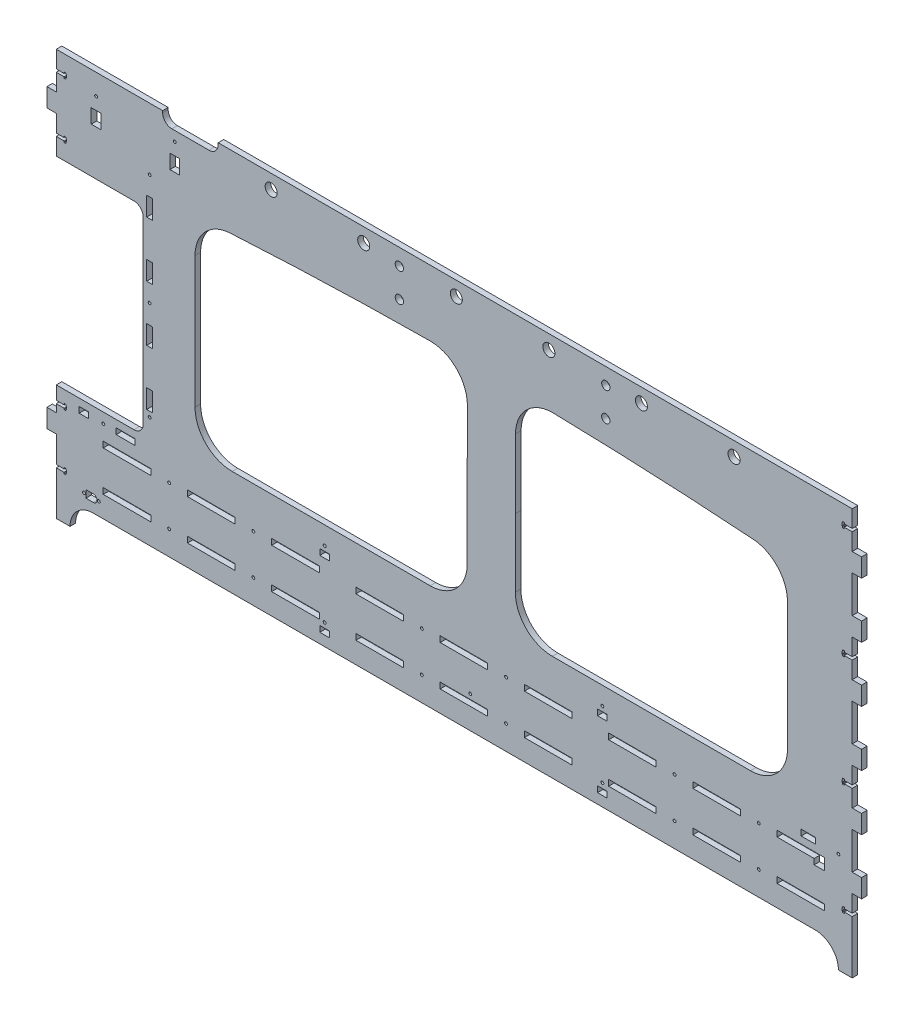
from build123d import *

# Parameters (mm, degrees)
SZKIC1_W                      = 880
SZKIC1_H                      = 439
DODANIE_WYCI_GNI_CIE1_DEPTH   = 6
WYTNIJ_WYCI_GNI_CIE1_DEPTH    = 6
WYTNIJ_WYCI_GNI_CIE2_DEPTH    = 6
WYTNIJ_WYCI_GNI_CIE3_DEPTH    = 6
SZKIC5_W                      = 10.1
SZKIC5_H                      = 40
WYTNIJ_WYCI_GNI_CIE5_DEPTH    = 6
SZYK_LINIOWY1_COUNT           = 8
SZYK_LINIOWY1_PITCH           = 60
SZYK_LINIOWY1_COUNT_DIR2      = 2
SZYK_LINIOWY1_PITCH_DIR2      = 400
WYTNIJ_WYCI_GNI_CIE6_DEPTH    = 1017.422152029
SZYK_LINIOWY2_COUNT           = 4
SZYK_LINIOWY2_PITCH           = 120
LUSTRO1_COPY_1_SKETCH_W       = 10.1
LUSTRO1_COPY_1_SKETCH_H       = 40
LUSTRO1_COPY_1_DEPTH          = 6
LUSTRO1_COPY_2_SKETCH_W       = 10.1
LUSTRO1_COPY_2_SKETCH_H       = 40
LUSTRO1_COPY_2_DEPTH          = 6
LUSTRO1_COPY_3_SKETCH_W       = 10.1
LUSTRO1_COPY_3_SKETCH_H       = 40
LUSTRO1_COPY_3_DEPTH          = 6
LUSTRO1_COPY_4_SKETCH_W       = 10.1
LUSTRO1_COPY_4_SKETCH_H       = 40
LUSTRO1_COPY_4_DEPTH          = 6
LUSTRO1_COPY_5_SKETCH_W       = 10.1
LUSTRO1_COPY_5_SKETCH_H       = 40
LUSTRO1_COPY_5_DEPTH          = 6
LUSTRO1_COPY_6_SKETCH_W       = 10.1
LUSTRO1_COPY_6_SKETCH_H       = 40
LUSTRO1_COPY_6_DEPTH          = 6
LUSTRO1_COPY_7_SKETCH_W       = 10.1
LUSTRO1_COPY_7_SKETCH_H       = 40
LUSTRO1_COPY_7_DEPTH          = 6
LUSTRO1_COPY_8_SKETCH_W       = 10.1
LUSTRO1_COPY_8_SKETCH_H       = 40
LUSTRO1_COPY_8_DEPTH          = 6
LUSTRO1_COPY_9_SKETCH_W       = 10.1
LUSTRO1_COPY_9_SKETCH_H       = 40
LUSTRO1_COPY_9_DEPTH          = 6
LUSTRO1_COPY_10_SKETCH_W      = 10.1
LUSTRO1_COPY_10_SKETCH_H      = 40
LUSTRO1_COPY_10_DEPTH         = 6
LUSTRO1_COPY_11_SKETCH_W      = 10.1
LUSTRO1_COPY_11_SKETCH_H      = 40
LUSTRO1_COPY_11_DEPTH         = 6
LUSTRO1_COPY_12_SKETCH_W      = 10.1
LUSTRO1_COPY_12_SKETCH_H      = 40
LUSTRO1_COPY_12_DEPTH         = 6
LUSTRO1_COPY_13_SKETCH_W      = 10.1
LUSTRO1_COPY_13_SKETCH_H      = 40
LUSTRO1_COPY_13_DEPTH         = 6
LUSTRO1_COPY_14_SKETCH_W      = 10.1
LUSTRO1_COPY_14_SKETCH_H      = 40
LUSTRO1_COPY_14_DEPTH         = 6
LUSTRO1_COPY_15_SKETCH_W      = 10.1
LUSTRO1_COPY_15_SKETCH_H      = 40
LUSTRO1_COPY_15_DEPTH         = 6
LUSTRO1_COPY_16_SKETCH_W      = 10.1
LUSTRO1_COPY_16_SKETCH_H      = 40
LUSTRO1_COPY_16_DEPTH         = 6
SZKIC18_W                     = 11.4
SZKIC18_H                     = 6.4
WYTNIJ_WYCI_GNI_CIE9_DEPTH    = 6
SZKIC19_R                     = 1.55
WYTNIJ_WYCI_GNI_CIE10_DEPTH   = 6
SZKIC22_R                     = 1.55
SZKIC22_W                     = 10.4
SZKIC22_H                     = 6.4
WYTNIJ_WYCI_GNI_CIE11_DEPTH   = 6
SZYK_LINIOWY5_COUNT           = 2
SZYK_LINIOWY5_PITCH           = 300
SZKIC26_R                     = 1.55
SZKIC26_W                     = 15.4
SZKIC26_H                     = 6.4
WYTNIJ_WYCI_GNI_CIE12_DEPTH   = 6
SZKIC28_R                     = 1.55
SZKIC28_W                     = 10.4
SZKIC28_H                     = 6.4
WYTNIJ_WYCI_GNI_CIE13_DEPTH   = 6
SZKIC30_R                     = 1.55
SZKIC30_W                     = 20.4
SZKIC30_H                     = 6.4
SZKIC30_W_2                   = 10.4
WYTNIJ_WYCI_GNI_CIE14_DEPTH   = 6
WYTNIJ_WYCI_GNI_CIE15_DEPTH   = 6
SZKIC33_R                     = 1.55
WYTNIJ_WYCI_GNI_CIE16_DEPTH   = 6
SZYK_LINIOWY6_COUNT           = 2
SZYK_LINIOWY6_PITCH           = 107
SZYK_LINIOWY6_COUNT_DIR2      = 2
SZYK_LINIOWY6_PITCH_DIR2      = 227
SZKIC35_W                     = 6.4
SZKIC35_H                     = 20.4
WYTNIJ_WYCI_GNI_CIE17_DEPTH   = 6
SZYK_LINIOWY7_COUNT           = 4
SZYK_LINIOWY7_PITCH           = 60
SZKIC37_R                     = 1.55
WYTNIJ_WYCI_GNI_CIE18_DEPTH   = 6
WYTNIJ_WYCI_GNI_CIE20_DEPTH   = 10
SZYK_LINIOWY9_COUNT           = 2
SZYK_LINIOWY9_PITCH           = 60
SZYK_LINIOWY9_COUNT_DIR2      = 2
SZYK_LINIOWY9_PITCH_DIR2      = 310
SZKIC44_R                     = 6.5
WYTNIJ_WYCI_GNI_CIE22_DEPTH   = 10
SZYK_LINIOWY10_COUNT          = 6
SZYK_LINIOWY10_PITCH          = 100
SZKIC45_R                     = 1.55
SZKIC45_W                     = 10.4
SZKIC45_H                     = 15.4
WYTNIJ_WYCI_GNI_CIE23_DEPTH   = 10
SZKIC49_R                     = 1.55
WYTNIJ_WYCI_GNI_CIE26_DEPTH   = 10
SZYK_LINIOWY12_COUNT          = 2
SZYK_LINIOWY12_PITCH          = 91
SZYK_LINIOWY12_COUNT_DIR2     = 3
SZYK_LINIOWY12_PITCH_DIR2     = 273
SZKIC52_W                     = 51.4
SZKIC52_H                     = 6.4
WYTNIJ_WYCI_GNI_CIE27_DEPTH   = 6
SZYK_LINIOWY13_COUNT          = 9
SZYK_LINIOWY13_PITCH          = 91
SZYK_LINIOWY4_COPY_1_SKETCH_W = 51.4
SZYK_LINIOWY4_COPY_1_SKETCH_H = 6.4
SZYK_LINIOWY4_COPY_1_DEPTH    = 6
SZYK_LINIOWY4_COPY_2_SKETCH_W = 51.4
SZYK_LINIOWY4_COPY_2_SKETCH_H = 6.4
SZYK_LINIOWY4_COPY_2_DEPTH    = 6
SZYK_LINIOWY4_COPY_3_SKETCH_W = 51.4
SZYK_LINIOWY4_COPY_3_SKETCH_H = 6.4
SZYK_LINIOWY4_COPY_3_DEPTH    = 6
SZYK_LINIOWY4_COPY_4_SKETCH_W = 51.4
SZYK_LINIOWY4_COPY_4_SKETCH_H = 6.4
SZYK_LINIOWY4_COPY_4_DEPTH    = 6
SZYK_LINIOWY4_COPY_5_SKETCH_W = 51.4
SZYK_LINIOWY4_COPY_5_SKETCH_H = 6.4
SZYK_LINIOWY4_COPY_5_DEPTH    = 6
SZYK_LINIOWY4_COPY_6_SKETCH_W = 51.4
SZYK_LINIOWY4_COPY_6_SKETCH_H = 6.4
SZYK_LINIOWY4_COPY_6_DEPTH    = 6
SZYK_LINIOWY4_COPY_7_SKETCH_W = 51.4
SZYK_LINIOWY4_COPY_7_SKETCH_H = 6.4
SZYK_LINIOWY4_COPY_7_DEPTH    = 6
SZYK_LINIOWY4_COPY_8_SKETCH_W = 51.4
SZYK_LINIOWY4_COPY_8_SKETCH_H = 6.4
SZYK_LINIOWY4_COPY_8_DEPTH    = 6
SZYK_LINIOWY4_COPY_9_SKETCH_W = 51.4
SZYK_LINIOWY4_COPY_9_SKETCH_H = 6.4
SZYK_LINIOWY4_COPY_9_DEPTH    = 6
SZKIC55_R                     = 4.5
WYTNIJ_WYCI_GNI_CIE28_DEPTH   = 10
DODANIE_WYCI_GNI_CIE2_DEPTH   = 6
SZKIC58_R                     = 1.55
WYTNIJ_WYCI_GNI_CIE30_DEPTH   = 6


with BuildPart() as part:
    # Szkic1 → Dodanie-wyciągnięcie1 (new body)
    with BuildSketch(Plane.XY):
        with Locations((440, -289.103962956)):
            Rectangle(SZKIC1_W, SZKIC1_H)
    extrude(amount=DODANIE_WYCI_GNI_CIE1_DEPTH)

    # Szkic2 → Wytnij-wyciągnięcie1 (cut)
    with BuildSketch(Plane.XY.offset(6)):
        with BuildLine():
            Line((25, -508.603962956), (855, -508.603962956))
            ThreePointArc((855, -508.603962956), (847.67766953, -490.926293426), (830, -483.603962956))
            Line((830, -483.603962956), (50, -483.603962956))
            ThreePointArc((50, -483.603962956), (32.32233047, -490.926293426), (25, -508.603962956))
        make_face()
    extrude(amount=-WYTNIJ_WYCI_GNI_CIE1_DEPTH, mode=Mode.SUBTRACT)

    # Szkic3 → Wytnij-wyciągnięcie2 (cut)
    with BuildSketch(Plane.XY.offset(6)):
        with BuildLine():
            Line((160, -187.643714192), (160, -329.603962956))
            ThreePointArc((160, -329.603962956), (171.715728753, -357.888234203), (200, -369.603962956))
            Line((200, -369.603962956), (760, -369.603962956))
            ThreePointArc((760, -369.603962956), (788.284271247, -357.888234203), (800, -329.603962956))
            Line((800, -329.603962956), (800, -191.492601365))
            ThreePointArc((800, -191.492601365), (789.276269567, -164.23640867), (762.854997988, -151.594619129))
            ThreePointArc((762.854997988, -151.594619129), (480.337059328, -140.527171371), (197.693684509, -147.710258182))
            ThreePointArc((197.693684509, -147.710258182), (170.911749626, -160.186953818), (160, -187.643714192))
        make_face()
    extrude(amount=-WYTNIJ_WYCI_GNI_CIE2_DEPTH, mode=Mode.SUBTRACT)

    # Szkic4 → Wytnij-wyciągnięcie3 (cut)
    with BuildSketch(Plane.XY.offset(6)):
        with BuildLine():
            Line((94, -383.603962956), (0, -383.603962956))
            Line((0, -383.603962956), (0, -169.603962956))
            Line((0, -169.603962956), (94, -169.603962956))
            ThreePointArc((94, -169.603962956), (101.071067812, -172.532895144), (104, -179.603962956))
            Line((104, -179.603962956), (104, -373.603962956))
            ThreePointArc((104, -373.603962956), (101.071067812, -380.675030768), (94, -383.603962956))
        make_face()
    extrude(amount=-WYTNIJ_WYCI_GNI_CIE3_DEPTH, mode=Mode.SUBTRACT)

    # Szkic5 → Wytnij-wyciągnięcie5 (cut)
    with BuildSketch(Plane(origin=(0, 0, 0), x_dir=(-1, 0, 0), z_dir=(0, 0, -1))):
        with Locations((-874.95, -89.603962956)):
            Rectangle(SZKIC5_W, SZKIC5_H)
    wytnij_wyci_gni_cie5 = extrude(amount=-WYTNIJ_WYCI_GNI_CIE5_DEPTH, mode=Mode.SUBTRACT)

    # Szyk liniowy1: Wytnij-wyci_gni_cie5 8 × 2
    with Locations(*[Vector(0, -1, 0) * (i * SZYK_LINIOWY1_PITCH) + Vector(0, -1, 0) * (j * SZYK_LINIOWY1_PITCH_DIR2) for i in range(SZYK_LINIOWY1_COUNT) for j in range(SZYK_LINIOWY1_COUNT_DIR2) if (i, j) != (0, 0)]):
        add(wytnij_wyci_gni_cie5, mode=Mode.SUBTRACT)

    # Szkic6 → Wytnij-wyciągnięcie6 (cut, through all)
    with BuildSketch(Plane(origin=(0, 0, 0), x_dir=(-1, 0, 0), z_dir=(0, 0, -1))):
        Polygon((-869.9, -88.053962956), (-869.9, -91.153962956), (-861.4, -91.153962956), (-861.4, -92.533962956), (-859.4, -92.533962956), (-859.4, -91.153962956), (-858.9, -91.153962956), (-858.9, -88.053962956), (-859.4, -88.053962956), (-859.4, -86.683962956), (-861.4, -86.683962956), (-861.4, -88.053962956), align=None)
    wytnij_wyci_gni_cie6 = extrude(amount=-WYTNIJ_WYCI_GNI_CIE6_DEPTH, mode=Mode.SUBTRACT)

    # Szyk liniowy2: Wytnij-wyciągnięcie6 ×4
    with Locations(*[(0, -i * SZYK_LINIOWY2_PITCH, 0) for i in range(1, SZYK_LINIOWY2_COUNT)]):
        add(wytnij_wyci_gni_cie6, mode=Mode.SUBTRACT)

    # Lustro1 copy 1 sketch → Lustro1 copy 1 (cut)
    with BuildSketch(Plane(origin=(880, -400, 0), x_dir=(1, 0, 0), z_dir=(0, 0, -1))):
        with Locations((-874.95, 89.603962956)):
            Rectangle(LUSTRO1_COPY_1_SKETCH_W, LUSTRO1_COPY_1_SKETCH_H)
    extrude(amount=-LUSTRO1_COPY_1_DEPTH, mode=Mode.SUBTRACT)

    # Lustro1 copy 2 sketch → Lustro1 copy 2 (cut)
    with BuildSketch(Plane(origin=(880, -60, 0), x_dir=(1, 0, 0), z_dir=(0, 0, -1))):
        with Locations((-874.95, 89.603962956)):
            Rectangle(LUSTRO1_COPY_2_SKETCH_W, LUSTRO1_COPY_2_SKETCH_H)
    extrude(amount=-LUSTRO1_COPY_2_DEPTH, mode=Mode.SUBTRACT)

    # Lustro1 copy 3 sketch → Lustro1 copy 3 (cut)
    with BuildSketch(Plane(origin=(880, -460, 0), x_dir=(1, 0, 0), z_dir=(0, 0, -1))):
        with Locations((-874.95, 89.603962956)):
            Rectangle(LUSTRO1_COPY_3_SKETCH_W, LUSTRO1_COPY_3_SKETCH_H)
    extrude(amount=-LUSTRO1_COPY_3_DEPTH, mode=Mode.SUBTRACT)

    # Lustro1 copy 4 sketch → Lustro1 copy 4 (cut)
    with BuildSketch(Plane(origin=(880, -120, 0), x_dir=(1, 0, 0), z_dir=(0, 0, -1))):
        with Locations((-874.95, 89.603962956)):
            Rectangle(LUSTRO1_COPY_4_SKETCH_W, LUSTRO1_COPY_4_SKETCH_H)
    extrude(amount=-LUSTRO1_COPY_4_DEPTH, mode=Mode.SUBTRACT)

    # Lustro1 copy 5 sketch → Lustro1 copy 5 (cut)
    with BuildSketch(Plane(origin=(880, -520, 0), x_dir=(1, 0, 0), z_dir=(0, 0, -1))):
        with Locations((-874.95, 89.603962956)):
            Rectangle(LUSTRO1_COPY_5_SKETCH_W, LUSTRO1_COPY_5_SKETCH_H)
    extrude(amount=-LUSTRO1_COPY_5_DEPTH, mode=Mode.SUBTRACT)

    # Lustro1 copy 6 sketch → Lustro1 copy 6 (cut)
    with BuildSketch(Plane(origin=(880, -180, 0), x_dir=(1, 0, 0), z_dir=(0, 0, -1))):
        with Locations((-874.95, 89.603962956)):
            Rectangle(LUSTRO1_COPY_6_SKETCH_W, LUSTRO1_COPY_6_SKETCH_H)
    extrude(amount=-LUSTRO1_COPY_6_DEPTH, mode=Mode.SUBTRACT)

    # Lustro1 copy 7 sketch → Lustro1 copy 7 (cut)
    with BuildSketch(Plane(origin=(880, -580, 0), x_dir=(1, 0, 0), z_dir=(0, 0, -1))):
        with Locations((-874.95, 89.603962956)):
            Rectangle(LUSTRO1_COPY_7_SKETCH_W, LUSTRO1_COPY_7_SKETCH_H)
    extrude(amount=-LUSTRO1_COPY_7_DEPTH, mode=Mode.SUBTRACT)

    # Lustro1 copy 8 sketch → Lustro1 copy 8 (cut)
    with BuildSketch(Plane(origin=(880, -240, 0), x_dir=(1, 0, 0), z_dir=(0, 0, -1))):
        with Locations((-874.95, 89.603962956)):
            Rectangle(LUSTRO1_COPY_8_SKETCH_W, LUSTRO1_COPY_8_SKETCH_H)
    extrude(amount=-LUSTRO1_COPY_8_DEPTH, mode=Mode.SUBTRACT)

    # Lustro1 copy 9 sketch → Lustro1 copy 9 (cut)
    with BuildSketch(Plane(origin=(880, -640, 0), x_dir=(1, 0, 0), z_dir=(0, 0, -1))):
        with Locations((-874.95, 89.603962956)):
            Rectangle(LUSTRO1_COPY_9_SKETCH_W, LUSTRO1_COPY_9_SKETCH_H)
    extrude(amount=-LUSTRO1_COPY_9_DEPTH, mode=Mode.SUBTRACT)

    # Lustro1 copy 10 sketch → Lustro1 copy 10 (cut)
    with BuildSketch(Plane(origin=(880, -300, 0), x_dir=(1, 0, 0), z_dir=(0, 0, -1))):
        with Locations((-874.95, 89.603962956)):
            Rectangle(LUSTRO1_COPY_10_SKETCH_W, LUSTRO1_COPY_10_SKETCH_H)
    extrude(amount=-LUSTRO1_COPY_10_DEPTH, mode=Mode.SUBTRACT)

    # Lustro1 copy 11 sketch → Lustro1 copy 11 (cut)
    with BuildSketch(Plane(origin=(880, -700, 0), x_dir=(1, 0, 0), z_dir=(0, 0, -1))):
        with Locations((-874.95, 89.603962956)):
            Rectangle(LUSTRO1_COPY_11_SKETCH_W, LUSTRO1_COPY_11_SKETCH_H)
    extrude(amount=-LUSTRO1_COPY_11_DEPTH, mode=Mode.SUBTRACT)

    # Lustro1 copy 12 sketch → Lustro1 copy 12 (cut)
    with BuildSketch(Plane(origin=(880, -360, 0), x_dir=(1, 0, 0), z_dir=(0, 0, -1))):
        with Locations((-874.95, 89.603962956)):
            Rectangle(LUSTRO1_COPY_12_SKETCH_W, LUSTRO1_COPY_12_SKETCH_H)
    extrude(amount=-LUSTRO1_COPY_12_DEPTH, mode=Mode.SUBTRACT)

    # Lustro1 copy 13 sketch → Lustro1 copy 13 (cut)
    with BuildSketch(Plane(origin=(880, -760, 0), x_dir=(1, 0, 0), z_dir=(0, 0, -1))):
        with Locations((-874.95, 89.603962956)):
            Rectangle(LUSTRO1_COPY_13_SKETCH_W, LUSTRO1_COPY_13_SKETCH_H)
    extrude(amount=-LUSTRO1_COPY_13_DEPTH, mode=Mode.SUBTRACT)

    # Lustro1 copy 14 sketch → Lustro1 copy 14 (cut)
    with BuildSketch(Plane(origin=(880, -420, 0), x_dir=(1, 0, 0), z_dir=(0, 0, -1))):
        with Locations((-874.95, 89.603962956)):
            Rectangle(LUSTRO1_COPY_14_SKETCH_W, LUSTRO1_COPY_14_SKETCH_H)
    extrude(amount=-LUSTRO1_COPY_14_DEPTH, mode=Mode.SUBTRACT)

    # Lustro1 copy 15 sketch → Lustro1 copy 15 (cut)
    with BuildSketch(Plane(origin=(880, -820, 0), x_dir=(1, 0, 0), z_dir=(0, 0, -1))):
        with Locations((-874.95, 89.603962956)):
            Rectangle(LUSTRO1_COPY_15_SKETCH_W, LUSTRO1_COPY_15_SKETCH_H)
    extrude(amount=-LUSTRO1_COPY_15_DEPTH, mode=Mode.SUBTRACT)

    # Lustro1 copy 16 sketch → Lustro1 copy 16 (cut)
    with BuildSketch(Plane(origin=(880, 0, 0), x_dir=(1, 0, 0), z_dir=(0, 0, -1))):
        with Locations((-874.95, 89.603962956)):
            Rectangle(LUSTRO1_COPY_16_SKETCH_W, LUSTRO1_COPY_16_SKETCH_H)
    extrude(amount=-LUSTRO1_COPY_16_DEPTH, mode=Mode.SUBTRACT)

    # Szkic18 → Wytnij-wyciągnięcie9 (cut)
    with BuildSketch(Plane(origin=(0, 0, 0), x_dir=(-1, 0, 0), z_dir=(0, 0, -1))):
        with Locations((-834.5, -420.103962956)):
            Rectangle(SZKIC18_W, SZKIC18_H)
    extrude(amount=-WYTNIJ_WYCI_GNI_CIE9_DEPTH, mode=Mode.SUBTRACT)

    # Szkic19 → Wytnij-wyciągnięcie10 (cut)
    with BuildSketch(Plane(origin=(0, 0, 0), x_dir=(-1, 0, 0), z_dir=(0, 0, -1))):
        with Locations((-769, -414.103962956)):
            Circle(SZKIC19_R)
    wytnij_wyci_gni_cie10 = extrude(amount=-WYTNIJ_WYCI_GNI_CIE10_DEPTH, mode=Mode.SUBTRACT)

    # Szkic22 → Wytnij-wyciągnięcie11 (cut)
    with BuildSketch(Plane(origin=(0, 0, 0), x_dir=(-1, 0, 0), z_dir=(0, 0, -1))):
        with Locations((-300.034826328, -460.972699115)):
            Circle(SZKIC22_R)
        with Locations((-300, -469.522699115)):
            Rectangle(SZKIC22_W, SZKIC22_H)
    wytnij_wyci_gni_cie11 = extrude(amount=-WYTNIJ_WYCI_GNI_CIE11_DEPTH, mode=Mode.SUBTRACT)

    # Szyk liniowy5: Wytnij-wyciągnięcie11 ×2
    with Locations(*[(i * SZYK_LINIOWY5_PITCH, 0, 0) for i in range(1, SZYK_LINIOWY5_COUNT)]):
        add(wytnij_wyci_gni_cie11, mode=Mode.SUBTRACT)

    # Szkic26 → Wytnij-wyciągnięcie12 (cut)
    with BuildSketch(Plane(origin=(0, 0, 0), x_dir=(-1, 0, 0), z_dir=(0, 0, -1))):
        with Locations((-855, -400.103962956)):
            Circle(SZKIC26_R)
        with Locations((-822.5, -400.103962956)):
            Rectangle(SZKIC26_W, SZKIC26_H)
    extrude(amount=-WYTNIJ_WYCI_GNI_CIE12_DEPTH, mode=Mode.SUBTRACT)

    # Szkic28 → Wytnij-wyciągnięcie13 (cut)
    with BuildSketch(Plane(origin=(0, 0, 0), x_dir=(-1, 0, 0), z_dir=(0, 0, -1))):
        with Locations((-600, -389.054878368)):
            Circle(SZKIC28_R)
        with Locations((-300, -389.054878368)):
            Circle(SZKIC28_R)
        with Locations((-600, -397.604878368)):
            Rectangle(SZKIC28_W, SZKIC28_H)
        with Locations((-300, -397.604878368)):
            Rectangle(SZKIC28_W, SZKIC28_H)
    extrude(amount=-WYTNIJ_WYCI_GNI_CIE13_DEPTH, mode=Mode.SUBTRACT)

    # Szkic30 → Wytnij-wyciągnięcie14 (cut)
    with BuildSketch(Plane(origin=(0, 0, 0), x_dir=(-1, 0, 0), z_dir=(0, 0, -1))):
        with Locations((-60.95, -394.603962956)):
            Circle(SZKIC30_R)
        with Locations((-85, -394.603962956)):
            Rectangle(SZKIC30_W, SZKIC30_H)
        with Locations((-40, -394.603962956)):
            Rectangle(SZKIC30_W_2, SZKIC30_H)
    extrude(amount=-WYTNIJ_WYCI_GNI_CIE14_DEPTH, mode=Mode.SUBTRACT)

    # Szkic31 → Wytnij-wyciągnięcie15 (cut)
    with BuildSketch(Plane(origin=(0, 0, 0), x_dir=(-1, 0, 0), z_dir=(0, 0, -1))):
        with BuildLine():
            Line((-185, -69.603962956), (-125, -69.603962956))
            Line((-125, -69.603962956), (-125, -71.603962956))
            ThreePointArc((-125, -71.603962956), (-127.928932188, -78.675030768), (-135, -81.603962956))
            Line((-135, -81.603962956), (-175, -81.603962956))
            ThreePointArc((-175, -81.603962956), (-182.071067812, -78.675030768), (-185, -71.603962956))
            Line((-185, -71.603962956), (-185, -69.603962956))
        make_face()
    extrude(amount=-WYTNIJ_WYCI_GNI_CIE15_DEPTH, mode=Mode.SUBTRACT)

    # Szkic33 → Wytnij-wyciągnięcie16 (cut)
    with BuildSketch(Plane(origin=(0, 0, 0), x_dir=(-1, 0, 0), z_dir=(0, 0, -1))):
        with Locations((-111, -363.603962956)):
            Circle(SZKIC33_R)
    wytnij_wyci_gni_cie16 = extrude(amount=-WYTNIJ_WYCI_GNI_CIE16_DEPTH, mode=Mode.SUBTRACT)

    # Szyk liniowy6: Wytnij-wyci_gni_cie16 2 × 2
    with Locations(*[Vector(0, 1, 0) * (i * SZYK_LINIOWY6_PITCH) + Vector(0, 1, 0) * (j * SZYK_LINIOWY6_PITCH_DIR2) for i in range(SZYK_LINIOWY6_COUNT) for j in range(SZYK_LINIOWY6_COUNT_DIR2) if (i, j) != (0, 0)]):
        add(wytnij_wyci_gni_cie16, mode=Mode.SUBTRACT)

    # Szkic35 → Wytnij-wyciągnięcie17 (cut)
    with BuildSketch(Plane(origin=(0, 0, 0), x_dir=(-1, 0, 0), z_dir=(0, 0, -1))):
        with Locations((-111, -347.603962956)):
            Rectangle(SZKIC35_W, SZKIC35_H)
    wytnij_wyci_gni_cie17 = extrude(amount=-WYTNIJ_WYCI_GNI_CIE17_DEPTH, mode=Mode.SUBTRACT)

    # Szyk liniowy7: Wytnij-wyciągnięcie17 ×4
    with Locations(*[(0, i * SZYK_LINIOWY7_PITCH, 0) for i in range(1, SZYK_LINIOWY7_COUNT)]):
        add(wytnij_wyci_gni_cie17, mode=Mode.SUBTRACT)

    # Szkic37 → Wytnij-wyciągnięcie18 (cut)
    with BuildSketch(Plane(origin=(0, 0, 0), x_dir=(-1, 0, 0), z_dir=(0, 0, -1))):
        with Locations((-56.1, -469.603962956)):
            Circle(SZKIC37_R)
        with Locations((-40.1, -469.603962956)):
            Circle(SZKIC37_R)
        with BuildLine():
            Line((-50.1, -473.603962956), (-42.1, -473.603962956))
            Line((-42.1, -473.603962956), (-42.1, -465.603962956))
            Line((-42.1, -465.603962956), (-50.1, -465.603962956))
            ThreePointArc((-50.1, -465.603962956), (-54.1, -469.603962956), (-50.1, -473.603962956))
        make_face()
    extrude(amount=-WYTNIJ_WYCI_GNI_CIE18_DEPTH, mode=Mode.SUBTRACT)

    # Szkic39 → Wytnij-wyciągnięcie20 (cut)
    with BuildSketch(Plane(origin=(0, 0, 0), x_dir=(-1, 0, 0), z_dir=(0, 0, -1))):
        Polygon((-10.1, -88.053962956), (-10.1, -91.153962956), (-18.6, -91.153962956), (-18.6, -92.528962956), (-20.6, -92.528962956), (-20.6, -91.153962956), (-21.1, -91.153962956), (-21.1, -88.053962956), (-20.6, -88.053962956), (-20.6, -86.678962956), (-18.6, -86.678962956), (-18.6, -88.053962956), align=None)
    wytnij_wyci_gni_cie20 = extrude(amount=-WYTNIJ_WYCI_GNI_CIE20_DEPTH, mode=Mode.SUBTRACT)

    # Szyk liniowy9: Wytnij-wyci_gni_cie20 2 × 2
    with Locations(*[Vector(0, -1, 0) * (i * SZYK_LINIOWY9_PITCH) + Vector(0, -1, 0) * (j * SZYK_LINIOWY9_PITCH_DIR2) for i in range(SZYK_LINIOWY9_COUNT) for j in range(SZYK_LINIOWY9_COUNT_DIR2) if (i, j) != (0, 0)]):
        add(wytnij_wyci_gni_cie20, mode=Mode.SUBTRACT)

    # Szkic44 → Wytnij-wyciągnięcie22 (cut)
    with BuildSketch(Plane(origin=(0, 0, 0), x_dir=(-1, 0, 0), z_dir=(0, 0, -1))):
        with Locations((-742.236985413, -84.914656906)):
            Circle(SZKIC44_R)
    wytnij_wyci_gni_cie22 = extrude(amount=-WYTNIJ_WYCI_GNI_CIE22_DEPTH, mode=Mode.SUBTRACT)

    # Szyk liniowy10: Wytnij-wyciągnięcie22 ×6
    with Locations(*[(-i * SZYK_LINIOWY10_PITCH, 0, 0) for i in range(1, SZYK_LINIOWY10_COUNT)]):
        add(wytnij_wyci_gni_cie22, mode=Mode.SUBTRACT)

    # Szkic45 → Wytnij-wyciągnięcie23 (cut)
    with BuildSketch(Plane(origin=(0, 0, 0), x_dir=(-1, 0, 0), z_dir=(0, 0, -1))):
        with Locations((-138.1, -92.153962956)):
            Circle(SZKIC45_R)
        with Locations((-53.1, -92.153962956)):
            Circle(SZKIC45_R)
        with Locations((-138.1, -113.103962956)):
            Rectangle(SZKIC45_W, SZKIC45_H)
        with Locations((-53.1, -113.103962956)):
            Rectangle(SZKIC45_W, SZKIC45_H)
    extrude(amount=-WYTNIJ_WYCI_GNI_CIE23_DEPTH, mode=Mode.SUBTRACT)

    # Szkic49 → Wytnij-wyciągnięcie26 (cut)
    with BuildSketch(Plane(origin=(0, 0, 0), x_dir=(-1, 0, 0), z_dir=(0, 0, -1))):
        with Locations((-222.996878644, -457.421631772)):
            Circle(SZKIC49_R)
        with Locations((-131.996878644, -457.421631772)):
            Circle(SZKIC49_R)
        with Locations((-405, -457.522699115)):
            Circle(SZKIC49_R)
        with Locations((-496, -457.522699115)):
            Circle(SZKIC49_R)
        with Locations((-678, -457.522699115)):
            Circle(SZKIC49_R)
        with Locations((-769, -457.522699115)):
            Circle(SZKIC49_R)
    extrude(amount=-WYTNIJ_WYCI_GNI_CIE26_DEPTH, mode=Mode.SUBTRACT)

    # Szyk liniowy12: Wytnij-wyci_gni_cie10 2 × 3
    with Locations(*[Vector(-1, 0, 0) * (i * SZYK_LINIOWY12_PITCH) + Vector(-1, 0, 0) * (j * SZYK_LINIOWY12_PITCH_DIR2) for i in range(SZYK_LINIOWY12_COUNT) for j in range(SZYK_LINIOWY12_COUNT_DIR2) if (i, j) != (0, 0)]):
        add(wytnij_wyci_gni_cie10, mode=Mode.SUBTRACT)

    # Szkic52 → Wytnij-wyciągnięcie27 (cut)
    with BuildSketch(Plane(origin=(0, 0, 0), x_dir=(-1, 0, 0), z_dir=(0, 0, -1))):
        with Locations((-814.5, -414.103962956)):
            Rectangle(SZKIC52_W, SZKIC52_H)
    wytnij_wyci_gni_cie27 = extrude(amount=-WYTNIJ_WYCI_GNI_CIE27_DEPTH, mode=Mode.SUBTRACT)

    # Szyk liniowy13: Wytnij-wyciągnięcie27 ×9
    with Locations(*[(-i * SZYK_LINIOWY13_PITCH, 0, 0) for i in range(1, SZYK_LINIOWY13_COUNT)]):
        add(wytnij_wyci_gni_cie27, mode=Mode.SUBTRACT)

    # Szyk liniowy4 copy 1 sketch → Szyk liniowy4 copy 1 (cut)
    with BuildSketch(Plane(origin=(-91, -43.42, 0), x_dir=(-1, 0, 0), z_dir=(0, 0, -1))):
        with Locations((-814.5, -414.103962956)):
            Rectangle(SZYK_LINIOWY4_COPY_1_SKETCH_W, SZYK_LINIOWY4_COPY_1_SKETCH_H)
    extrude(amount=-SZYK_LINIOWY4_COPY_1_DEPTH, mode=Mode.SUBTRACT)

    # Szyk liniowy4 copy 2 sketch → Szyk liniowy4 copy 2 (cut)
    with BuildSketch(Plane(origin=(-182, -43.42, 0), x_dir=(-1, 0, 0), z_dir=(0, 0, -1))):
        with Locations((-814.5, -414.103962956)):
            Rectangle(SZYK_LINIOWY4_COPY_2_SKETCH_W, SZYK_LINIOWY4_COPY_2_SKETCH_H)
    extrude(amount=-SZYK_LINIOWY4_COPY_2_DEPTH, mode=Mode.SUBTRACT)

    # Szyk liniowy4 copy 3 sketch → Szyk liniowy4 copy 3 (cut)
    with BuildSketch(Plane(origin=(-273, -43.42, 0), x_dir=(-1, 0, 0), z_dir=(0, 0, -1))):
        with Locations((-814.5, -414.103962956)):
            Rectangle(SZYK_LINIOWY4_COPY_3_SKETCH_W, SZYK_LINIOWY4_COPY_3_SKETCH_H)
    extrude(amount=-SZYK_LINIOWY4_COPY_3_DEPTH, mode=Mode.SUBTRACT)

    # Szyk liniowy4 copy 4 sketch → Szyk liniowy4 copy 4 (cut)
    with BuildSketch(Plane(origin=(-364, -43.42, 0), x_dir=(-1, 0, 0), z_dir=(0, 0, -1))):
        with Locations((-814.5, -414.103962956)):
            Rectangle(SZYK_LINIOWY4_COPY_4_SKETCH_W, SZYK_LINIOWY4_COPY_4_SKETCH_H)
    extrude(amount=-SZYK_LINIOWY4_COPY_4_DEPTH, mode=Mode.SUBTRACT)

    # Szyk liniowy4 copy 5 sketch → Szyk liniowy4 copy 5 (cut)
    with BuildSketch(Plane(origin=(-455, -43.42, 0), x_dir=(-1, 0, 0), z_dir=(0, 0, -1))):
        with Locations((-814.5, -414.103962956)):
            Rectangle(SZYK_LINIOWY4_COPY_5_SKETCH_W, SZYK_LINIOWY4_COPY_5_SKETCH_H)
    extrude(amount=-SZYK_LINIOWY4_COPY_5_DEPTH, mode=Mode.SUBTRACT)

    # Szyk liniowy4 copy 6 sketch → Szyk liniowy4 copy 6 (cut)
    with BuildSketch(Plane(origin=(-546, -43.42, 0), x_dir=(-1, 0, 0), z_dir=(0, 0, -1))):
        with Locations((-814.5, -414.103962956)):
            Rectangle(SZYK_LINIOWY4_COPY_6_SKETCH_W, SZYK_LINIOWY4_COPY_6_SKETCH_H)
    extrude(amount=-SZYK_LINIOWY4_COPY_6_DEPTH, mode=Mode.SUBTRACT)

    # Szyk liniowy4 copy 7 sketch → Szyk liniowy4 copy 7 (cut)
    with BuildSketch(Plane(origin=(-637, -43.42, 0), x_dir=(-1, 0, 0), z_dir=(0, 0, -1))):
        with Locations((-814.5, -414.103962956)):
            Rectangle(SZYK_LINIOWY4_COPY_7_SKETCH_W, SZYK_LINIOWY4_COPY_7_SKETCH_H)
    extrude(amount=-SZYK_LINIOWY4_COPY_7_DEPTH, mode=Mode.SUBTRACT)

    # Szyk liniowy4 copy 8 sketch → Szyk liniowy4 copy 8 (cut)
    with BuildSketch(Plane(origin=(-728, -43.42, 0), x_dir=(-1, 0, 0), z_dir=(0, 0, -1))):
        with Locations((-814.5, -414.103962956)):
            Rectangle(SZYK_LINIOWY4_COPY_8_SKETCH_W, SZYK_LINIOWY4_COPY_8_SKETCH_H)
    extrude(amount=-SZYK_LINIOWY4_COPY_8_DEPTH, mode=Mode.SUBTRACT)

    # Szyk liniowy4 copy 9 sketch → Szyk liniowy4 copy 9 (cut)
    with BuildSketch(Plane(origin=(0, -43.42, 0), x_dir=(-1, 0, 0), z_dir=(0, 0, -1))):
        with Locations((-814.5, -414.103962956)):
            Rectangle(SZYK_LINIOWY4_COPY_9_SKETCH_W, SZYK_LINIOWY4_COPY_9_SKETCH_H)
    extrude(amount=-SZYK_LINIOWY4_COPY_9_DEPTH, mode=Mode.SUBTRACT)

    # Szkic55 → Wytnij-wyciągnięcie28 (cut)
    with BuildSketch(Plane(origin=(0, 0, 0), x_dir=(-1, 0, 0), z_dir=(0, 0, -1))):
        with Locations((-380.736985413, -87.303962956)):
            Circle(SZKIC55_R)
        with Locations((-380.736985413, -118.303962956)):
            Circle(SZKIC55_R)
        with Locations((-603.736985413, -118.303962956)):
            Circle(SZKIC55_R)
        with Locations((-603.736985413, -87.303962956)):
            Circle(SZKIC55_R)
    extrude(amount=-WYTNIJ_WYCI_GNI_CIE28_DEPTH, mode=Mode.SUBTRACT)


with BuildPart() as body_2:
    # Szkic57 → Dodanie-wyciągnięcie2 (new body)
    with BuildSketch(Plane(origin=(0, 0, 0), x_dir=(-1, 0, 0), z_dir=(0, 0, -1))):
        with BuildLine():
            Line((-454, -255.957504541), (-454, -329.603962956))
            ThreePointArc((-454, -329.603962956), (-442.284271247, -357.888234203), (-414, -369.603962956))
            Line((-414, -369.603962956), (-546, -369.603962956))
            ThreePointArc((-546, -369.603962956), (-517.715728753, -357.888234203), (-506, -329.603962956))
            Line((-506, -329.603962956), (-506, -256.160172602))
            Line((-506, -256.160172602), (-506.209024254, -181.37325427))
            ThreePointArc((-506.209024254, -181.37325427), (-517.846843508, -153.278747414), (-545.876852058, -141.486429018))
            Line((-545.876852058, -141.486429018), (-546.208868022, -137.55775586))
            Line((-546.208868022, -137.55775586), (-415.095101556, -137.55775586))
            Line((-415.095101556, -137.55775586), (-415.095101556, -140.583013052))
            ThreePointArc((-415.095101556, -140.583013052), (-442.844898054, -152.643437049), (-454.210381356, -180.68502798))
            Line((-454.210381356, -180.68502798), (-454, -255.957504541))
        make_face()
    extrude(amount=-DODANIE_WYCI_GNI_CIE2_DEPTH)


with BuildPart() as part_1:
    add(part.part)

    # Połącz1: union body 2
    add(body_2.part)

    # Szkic58 → Wytnij-wyciągnięcie30 (cut)
    with BuildSketch(Plane(origin=(0, 0, 0), x_dir=(-1, 0, 0), z_dir=(0, 0, -1))):
        with Locations((-457.249999945, -449.023962956)):
            Circle(SZKIC58_R)
    extrude(amount=-WYTNIJ_WYCI_GNI_CIE30_DEPTH, mode=Mode.SUBTRACT)


solid = part_1.part
